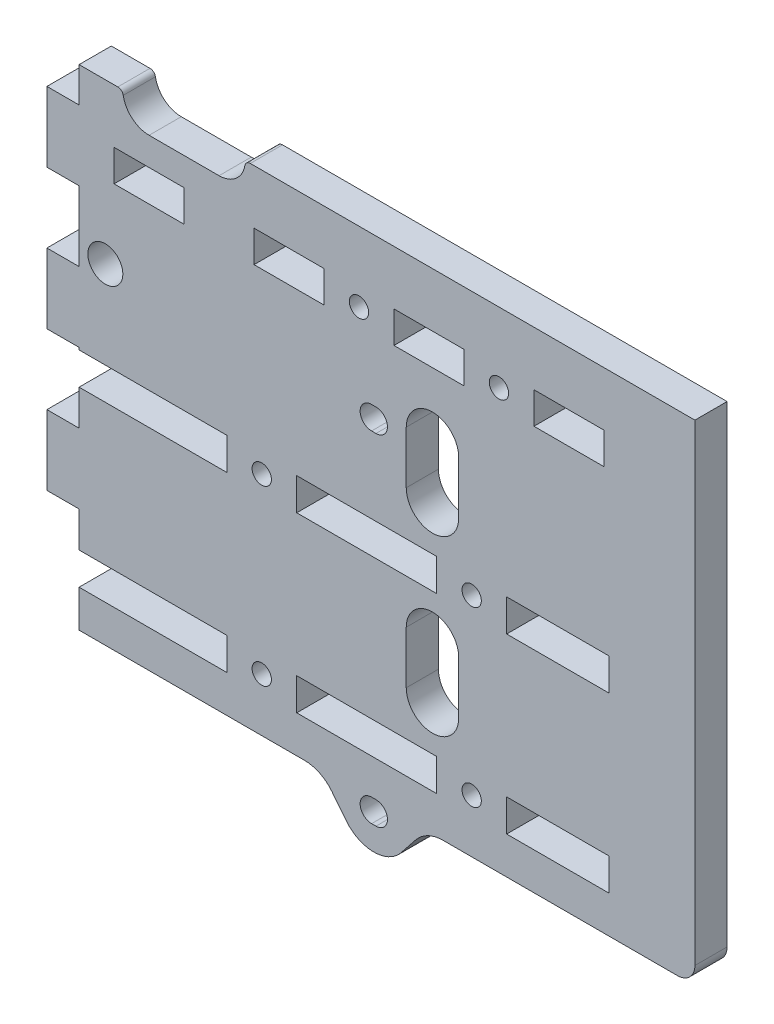
from build123d import *

# Parameters (mm, degrees)
SKETCH1_R           = 1.7526
SKETCH1_W           = 12.7
SKETCH1_H           = 5.742
BOSS_EXTRUDE1_DEPTH = 5.842
SKETCH2_R           = 3.175
CUT_EXTRUDE1_DEPTH  = 82.290714919
FILLET1_R           = 6.35
CUT_EXTRUDE2_DEPTH  = 82.290714919
FILLET2_R           = 1
FILLET3_R           = 3.175
CUT_EXTRUDE3_DEPTH  = 82.290714919


with BuildPart() as part:
    # Sketch1 → Boss-Extrude1 (new body)
    with BuildSketch(Plane.XY):
        with BuildLine():
            Line((-61.722, 0), (-61.722, 12.7))
            Line((-61.722, 12.7), (-55.88, 12.7))
            Line((-55.88, 12.7), (-55.88, 25.4))
            Line((-55.88, 25.4), (-61.722, 25.4))
            Line((-61.722, 25.4), (-61.722, 38.1))
            Line((-61.722, 38.1), (-55.88, 38.1))
            Line((-55.88, 38.1), (-55.88, 44.45))
            Line((-55.88, 44.45), (55.88, 44.45))
            Line((55.88, 44.45), (55.88, -44.45))
            Line((55.88, -44.45), (7.127875, -44.45))
            Line((7.127875, -44.45), (2.573780292, -50.179278348))
            ThreePointArc((2.573780292, -50.179278348), (-2.397125, -52.578), (-7.368030292, -50.179278348))
            Line((-7.368030292, -50.179278348), (-11.922125, -44.45))
            Line((-11.922125, -44.45), (-55.88, -44.45))
            Line((-55.88, -44.45), (-55.88, -37.692))
            Line((-55.88, -37.692), (-29.083, -37.692))
            Line((-29.083, -37.692), (-29.083, -31.85))
            Line((-29.083, -31.85), (-55.88, -31.85))
            Line((-55.88, -31.85), (-55.88, -25.4))
            Line((-55.88, -25.4), (-61.722, -25.4))
            Line((-61.722, -25.4), (-61.722, -12.7))
            Line((-61.722, -12.7), (-55.88, -12.7))
            Line((-55.88, -12.7), (-55.88, -6.25))
            Line((-55.88, -6.25), (-29.083, -6.25))
            Line((-29.083, -6.25), (-29.083, -0.408))
            Line((-29.083, -0.408), (-55.88, -0.408))
            Line((-55.88, -0.408), (-55.88, 0))
            Line((-55.88, 0), (-61.722, 0))
        make_face()
        with Locations((-22.733, -3.329)):
            Circle(SKETCH1_R, mode=Mode.SUBTRACT)
        with Locations((15.367, -3.329)):
            Circle(SKETCH1_R, mode=Mode.SUBTRACT)
        with Locations((15.367, -34.771)):
            Circle(SKETCH1_R, mode=Mode.SUBTRACT)
        with Locations((-22.733, -34.771)):
            Circle(SKETCH1_R, mode=Mode.SUBTRACT)
        with Locations((-5.08, 31.75)):
            Circle(SKETCH1_R, mode=Mode.SUBTRACT)
        with Locations((20.32, 31.75)):
            Circle(SKETCH1_R, mode=Mode.SUBTRACT)
        Polygon((9.017, -0.408), (-10.541, -0.408), (-16.383, -0.408), (-16.383, -6.25), (-10.541, -6.25), (9.017, -6.25), align=None, mode=Mode.SUBTRACT)
        Polygon((27.559, -0.408), (21.717, -0.408), (21.717, -6.25), (27.559, -6.25), (40.259, -6.25), (40.259, -0.408), align=None, mode=Mode.SUBTRACT)
        Polygon((21.717, -37.692), (21.717, -31.85), (27.559, -31.85), (40.259, -31.85), (40.259, -37.692), (27.559, -37.692), align=None, mode=Mode.SUBTRACT)
        Polygon((-16.383, -37.692), (-16.383, -31.85), (-10.541, -31.85), (9.017, -31.85), (9.017, -37.692), (-10.541, -37.692), align=None, mode=Mode.SUBTRACT)
        with BuildLine():
            Line((-2.794, -44.1452), (-2.00025, -44.1452))
            ThreePointArc((-2.00025, -44.1452), (0.08255, -46.228), (-2.00025, -48.3108))
            Line((-2.00025, -48.3108), (-2.794, -48.3108))
            ThreePointArc((-2.794, -48.3108), (-4.8768, -46.228), (-2.794, -44.1452))
        make_face(mode=Mode.SUBTRACT)
        with BuildLine():
            Line((-2.794, 17.5768), (-2.00025, 17.5768))
            ThreePointArc((-2.00025, 17.5768), (0.08255, 15.494), (-2.00025, 13.4112))
            Line((-2.00025, 13.4112), (-2.794, 13.4112))
            ThreePointArc((-2.794, 13.4112), (-4.8768, 15.494), (-2.794, 17.5768))
        make_face(mode=Mode.SUBTRACT)
        with Locations((-17.78, 31.75)):
            Rectangle(SKETCH1_W, SKETCH1_H, mode=Mode.SUBTRACT)
        with Locations((-43.18, 31.75)):
            Rectangle(SKETCH1_W, SKETCH1_H, mode=Mode.SUBTRACT)
        with Locations((7.62, 31.75)):
            Rectangle(SKETCH1_W, SKETCH1_H, mode=Mode.SUBTRACT)
        with Locations((33.02, 31.75)):
            Rectangle(SKETCH1_W, SKETCH1_H, mode=Mode.SUBTRACT)
    extrude(amount=BOSS_EXTRUDE1_DEPTH)

    # Sketch2 → Cut-Extrude1 (cut, through all)
    with BuildSketch(Plane.XY.offset(5.842)):
        with Locations((-51.1175, 15.494)):
            Circle(SKETCH2_R)
    extrude(amount=-CUT_EXTRUDE1_DEPTH, mode=Mode.SUBTRACT)

    # Fillet1
    fillet1_edges = [part.edges().sort_by_distance(p)[0] for p in [
        (7.127875, -44.45, 2.921),
        (-11.922125, -44.45, 2.921),
    ]]
    fillet(fillet1_edges, radius=FILLET1_R)

    # Sketch4 → Cut-Extrude2 (cut, through all)
    with BuildSketch(Plane.XY.offset(5.842)):
        with BuildLine():
            Line((-43.18, 49.2125), (-30.48, 49.2125))
            ThreePointArc((-30.48, 49.2125), (-25.7175, 44.45), (-30.48, 39.6875))
            Line((-30.48, 39.6875), (-43.18, 39.6875))
            ThreePointArc((-43.18, 39.6875), (-47.9425, 44.45), (-43.18, 49.2125))
        make_face()
    extrude(amount=-CUT_EXTRUDE2_DEPTH, mode=Mode.SUBTRACT)

    # Fillet2
    fillet2_edges = [part.edges().sort_by_distance(p)[0] for p in [
        (-25.7175, 44.45, 2.921),
        (-47.9425, 44.45, 2.921),
    ]]
    fillet(fillet2_edges, radius=FILLET2_R)

    # Fillet3
    fillet3_edges = [part.edges().sort_by_distance(p)[0] for p in [
        (55.88, -44.45, 2.921),
    ]]
    fillet(fillet3_edges, radius=FILLET3_R)

    # Sketch5 → Cut-Extrude3 (cut, through all)
    with BuildSketch(Plane.XY.offset(5.842)):
        with BuildLine():
            Line((3.4925, -23.8125), (3.4925, -14.2875))
            ThreePointArc((3.4925, -14.2875), (8.255, -9.525), (13.0175, -14.2875))
            Line((13.0175, -14.2875), (13.0175, -23.8125))
            ThreePointArc((13.0175, -23.8125), (8.255, -28.575), (3.4925, -23.8125))
        make_face()
        with BuildLine():
            Line((3.4925, 17.1545), (3.4925, 7.6295))
            ThreePointArc((3.4925, 7.6295), (8.255, 2.867), (13.0175, 7.6295))
            Line((13.0175, 7.6295), (13.0175, 17.1545))
            ThreePointArc((13.0175, 17.1545), (8.255, 21.917), (3.4925, 17.1545))
        make_face()
    extrude(amount=-CUT_EXTRUDE3_DEPTH, mode=Mode.SUBTRACT)


solid = part.part
